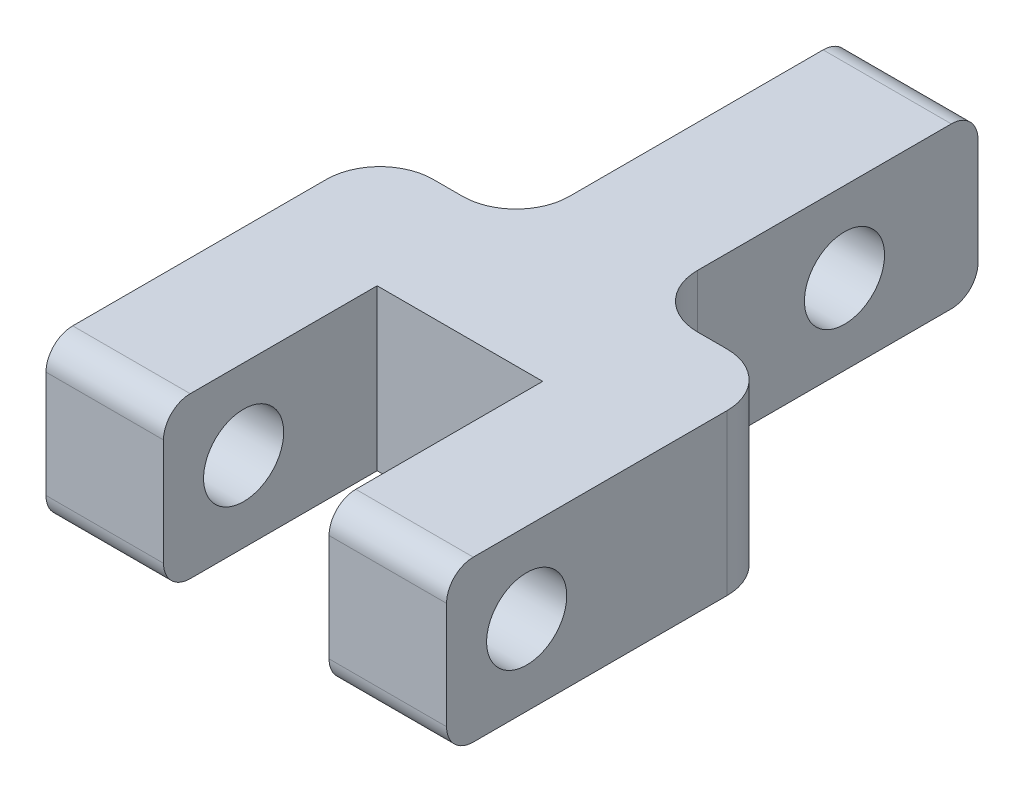
from build123d import *
from build123d.topology import SkipClean

# Parameters (mm, degrees)
SALIENTE_EXTRUIR1_DEPTH    = 2.4
CORTAR_EXTRUIR1_DEPTH      = 14.077079185
CORTAR_EXTRUIR1_DEPTH_BACK = 14.077079185
CROQUIS2_R                 = 1.5
CROQUIS3_R                 = 1.5
SALIENTE_EXTRUIR2_DEPTH    = 7.5
CORTAR_EXTRUIR2_DEPTH      = 3.1
REDONDEO1_R                = 2


with BuildPart() as part:
    # Croquis1 → Saliente-Extruir1 (new, symmetric)
    with BuildSketch(Plane(origin=(0, 0, 0), x_dir=(0, 0, -1), z_dir=(1, 0, 0))):
        with BuildLine():
            Line((-11.5, 3), (11.5, 3))
            ThreePointArc((11.5, 3), (12.207106781, 2.707106781), (12.5, 2))
            Line((12.5, 2), (12.5, -2))
            ThreePointArc((12.5, -2), (12.207106781, -2.707106781), (11.5, -3))
            Line((11.5, -3), (-11.5, -3))
            ThreePointArc((-11.5, -3), (-12.207106781, -2.707106781), (-12.5, -2))
            Line((-12.5, -2), (-12.5, 2))
            ThreePointArc((-12.5, 2), (-12.207106781, 2.707106781), (-11.5, 3))
        make_face()
    extrude(amount=SALIENTE_EXTRUIR1_DEPTH, both=True)

    # Croquis2 → Cortar-Extruir1 (cut, two sides: drawn at the far end of the back side and taken through both)
    with BuildSketch(Plane(origin=(0, 0, 0), x_dir=(0, 0, -1), z_dir=(1, 0, 0)).offset(-CORTAR_EXTRUIR1_DEPTH_BACK)):
        with Locations((-9.5, 0)):
            Circle(CROQUIS2_R)
        with Locations((7.5, 0)):
            Circle(CROQUIS2_R)
    extrude(amount=CORTAR_EXTRUIR1_DEPTH + CORTAR_EXTRUIR1_DEPTH_BACK, mode=Mode.SUBTRACT)

    # Croquis3 → Saliente-Extruir2 (add, symmetric)
    with SkipClean():  # the faces are left unmerged after this step: merging them gives an invalid solid
        with BuildSketch(Plane(origin=(0, 0, 0), x_dir=(0, 0, -1), z_dir=(1, 0, 0))):
            with BuildLine():
                Line((-12.5, 2), (-12.5, -2))
                ThreePointArc((-12.5, -2), (-12.207106781, -2.707106781), (-11.5, -3))
                Line((-11.5, -3), (0, -3))
                Line((0, -3), (0, 3))
                Line((0, 3), (-11.5, 3))
                ThreePointArc((-11.5, 3), (-12.207106781, 2.707106781), (-12.5, 2))
            make_face()
            with Locations((-9.5, 0)):
                Circle(CROQUIS3_R, mode=Mode.SUBTRACT)
        extrude(amount=SALIENTE_EXTRUIR2_DEPTH, both=True)
    add(part.part.scale(1), mode=Mode.REPLACE)  # the faces are merged on a copy

    # Croquis4 → Cortar-Extruir2 (cut, symmetric)
    with BuildSketch(Plane(origin=(0, 0, 0), x_dir=(0, 0, -1), z_dir=(1, 0, 0))):
        with BuildLine():
            Line((-11.5, 3), (-4.5, 3))
            Line((-4.5, 3), (-4.5, -3))
            Line((-4.5, -3), (-11.5, -3))
            ThreePointArc((-11.5, -3), (-12.207106781, -2.707106781), (-12.5, -2))
            Line((-12.5, -2), (-12.5, 2))
            ThreePointArc((-12.5, 2), (-12.207106781, 2.707106781), (-11.5, 3))
        make_face()
    extrude(amount=CORTAR_EXTRUIR2_DEPTH, both=True, mode=Mode.SUBTRACT)

    # Redondeo1
    redondeo1_edges = [part.edges().sort_by_distance(p)[0] for p in [
        (2.4, 0, 0),
        (-2.4, 0, 0),
        (7.5, 0, 0),
        (-7.5, 0, 0),
    ]]
    fillet(redondeo1_edges, radius=REDONDEO1_R)


solid = part.part
